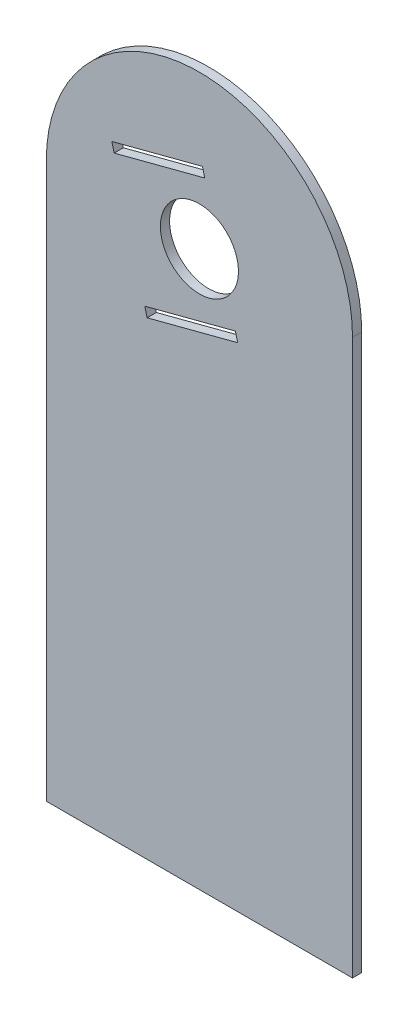
from build123d import *

# Parameters (mm, degrees)
SKETCH1_R           = 6.477
BOSS_EXTRUDE1_DEPTH = 1.524


with BuildPart() as part:
    # Sketch1 → Boss-Extrude1 (new body)
    with BuildSketch(Plane.XY):
        with BuildLine():
            Line((-34.05306863, -35.011654825), (-34.05306863, -127.07412464))
            Line((-34.05306863, -127.07412464), (-84.85306863, -127.07412464))
            Line((-84.85306863, -127.07412464), (-84.85306863, -35.011654825))
            ThreePointArc((-84.85306863, -35.011654825), (-59.45306863, -9.611654825), (-34.05306863, -35.011654825))
        make_face()
        with Locations((-59.45306863, -35.011654825)):
            Circle(SKETCH1_R, mode=Mode.SUBTRACT)
        Polygon((-73.98823577, -26.847732201), (-73.602306269, -28.322057274), (-58.572284175, -24.387695013), (-58.958213676, -22.91336994), align=None, mode=Mode.SUBTRACT)
        Polygon((-53.093996811, -45.315808559), (-53.479926312, -43.841483486), (-68.509948406, -47.775845746), (-68.124018905, -49.250170819), align=None, mode=Mode.SUBTRACT)
    extrude(amount=BOSS_EXTRUDE1_DEPTH)


solid = part.part
